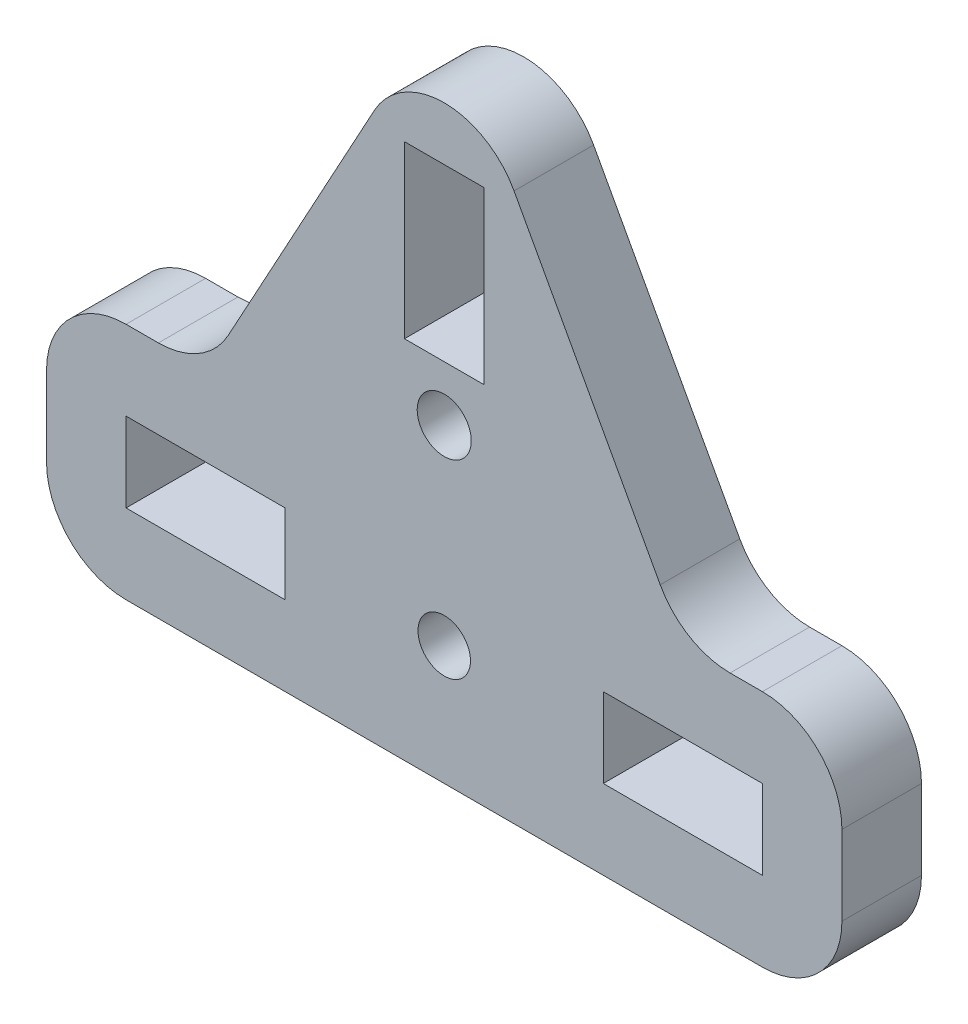
from build123d import *

# Parameters (mm, degrees)
SKETCH1_W           = 63.5
SKETCH1_H           = 19.05
BOSS_EXTRUDE1_DEPTH = 6.35
SKETCH2_R           = 2.0955
SKETCH2_W           = 12.7
SKETCH2_H           = 6.35
CUT_EXTRUDE1_DEPTH  = 6.35
BOSS_EXTRUDE2_DEPTH = 6.35
SKETCH4_R           = 2.159
SKETCH4_W           = 6.35
SKETCH4_H           = 13.6271
CUT_EXTRUDE3_DEPTH  = 6.35
FILLET1_R           = 6.35


with BuildPart() as part:
    # Sketch1 → Boss-Extrude1 (new body)
    with BuildSketch(Plane.XY):
        Rectangle(SKETCH1_W, SKETCH1_H)
    extrude(amount=BOSS_EXTRUDE1_DEPTH)

    # Sketch2 → Cut-Extrude1 (cut)
    with BuildSketch(Plane.XY.offset(6.35)):
        Circle(SKETCH2_R)
        with Locations((-19.05, 0)):
            Rectangle(SKETCH2_W, SKETCH2_H)
        with Locations((19.05, 0)):
            Rectangle(SKETCH2_W, SKETCH2_H)
    extrude(amount=-CUT_EXTRUDE1_DEPTH, mode=Mode.SUBTRACT)

    # Sketch3 → Boss-Extrude2 (add)
    with BuildSketch(Plane.XY.offset(6.35)):
        with BuildLine():
            Line((-19.05, 9.525), (19.05, 9.525))
            Line((19.05, 9.525), (5.574636947, 34.229832265))
            ThreePointArc((5.574636947, 34.229832265), (1.46e-07, 37.539121342), (-5.574636807, 34.229832521))
            Line((-5.574636807, 34.229832521), (-19.05, 9.525))
        make_face()
    extrude(amount=-BOSS_EXTRUDE2_DEPTH)

    # Sketch4 → Cut-Extrude3 (cut)
    with BuildSketch(Plane(origin=(0, 0, 0), x_dir=(-1, 0, 0), z_dir=(0, 0, -1))):
        with Locations((0, 15.24)):
            Circle(SKETCH4_R)
        with Locations((0, 26.449976884)):
            Rectangle(SKETCH4_W, SKETCH4_H)
    extrude(amount=-CUT_EXTRUDE3_DEPTH, mode=Mode.SUBTRACT)

    # Fillet1
    fillet1_edges = [part.edges().sort_by_distance(p)[0] for p in [
        (31.75, -9.525, 3.175),
        (31.75, 9.525, 3.175),
        (19.05, 9.525, 3.175),
        (-31.75, -9.525, 3.175),
        (-31.75, 9.525, 3.175),
        (-19.05, 9.525, 3.175),
    ]]
    fillet(fillet1_edges, radius=FILLET1_R)


solid = part.part
